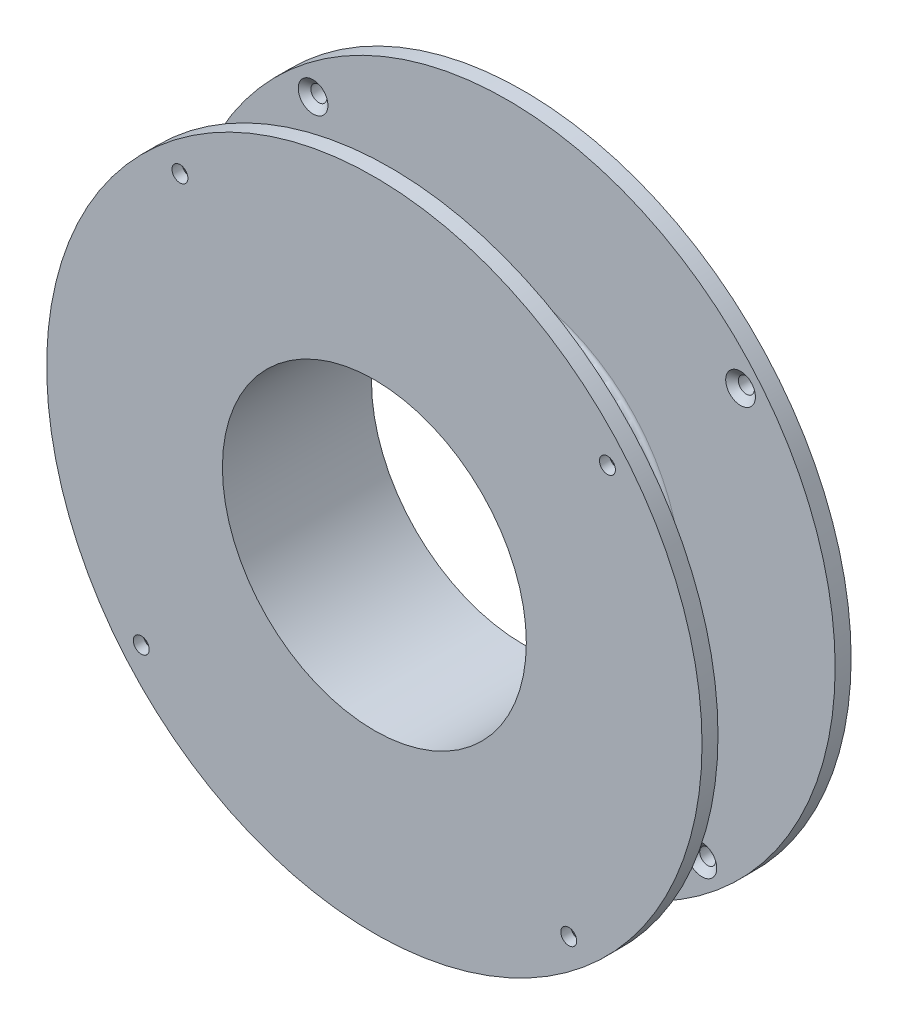
from build123d import *

# Parameters (mm, degrees)
SKETCH2_R          = 1.8288
CUT_EXTRUDE1_DEPTH = 143.234851149
CIRPATTERN1_COUNT  = 4


# Read off the part's stored shape, not the designer's step: CSK for #6 Flat Head Machine Screw (100)1
with BuildPart() as part:
    # Sketch1 → Revolve8 (revolve)
    with BuildSketch(Plane(origin=(0, 0, 0), x_dir=(1, 0, 0), z_dir=(0, 1, 0)), mode=Mode.PRIVATE) as revolve8_sk:
        with BuildLine():
            Line((-42.91, 4.059999872), (-1, 4.059999872))
            Line((-1, 4.059999872), (-1, -31.500000128))
            Line((-1, -31.500000128), (-42.91, -31.500000128))
            Line((-42.91, -31.500000128), (-42.91, -27.690000128))
            Line((-42.91, -27.690000128), (-6.08, -27.690000128))
            ThreePointArc((-6.08, -27.690000128), (-5.181974388, -27.31802574), (-4.81, -26.420000128))
            Line((-4.81, -26.420000128), (-4.81, -1.020000128))
            ThreePointArc((-4.81, -1.020000128), (-5.181974388, -0.121974516), (-6.08, 0.249999872))
            Line((-6.08, 0.249999872), (-42.91, 0.249999872))
            Line((-42.91, 0.249999872), (-42.91, 4.059999872))
        make_face()
    revolve(revolve8_sk.sketch.rotate(Axis((35.2425, 0, 32.45), (0, 0, -1)), 180), axis=Axis((35.2425, 0, 32.45), (0, 0, -1)))

    # Sketch2 → Cut-Extrude1 (cut, through all)
    with BuildSketch(Plane(origin=(0, 0, -4.059999872), x_dir=(-1, 0, 0), z_dir=(0, 0, -1))):
        with Locations((11.122317884, 55.593306815)):
            Circle(SKETCH2_R)
    cut_extrude1 = extrude(amount=-CUT_EXTRUDE1_DEPTH, mode=Mode.SUBTRACT)

    # CirPattern1: Cut-Extrude1 ×4 about axis
    cirpattern1_axis = Axis((35.2425, 0, 0), (0, 0, 1))
    for i in range(1, CIRPATTERN1_COUNT):
        add(cut_extrude1.rotate(cirpattern1_axis, i * 360 / CIRPATTERN1_COUNT), mode=Mode.SUBTRACT)

    # CSK for _6 Flat Head Machine Screw _ 2 → CSK for #6 Flat Head Machine Screw (100)1 (revolve, cut)
    with BuildSketch(Plane(origin=(-11.122317884, 55.593306815, 0), x_dir=(1, 0, 0), z_dir=(0, -1, 0))):
        Polygon((1.89865, 29.070025336), (1.89865, 31.500000128), (1.8288, 31.500000128), (1.8288, 27.690000128), (3.5433, 27.690000128), align=None)
        Polygon((1.89865, -1.63002508), (3.5433, -0.249999872), (1.8288, -0.249999872), (1.8288, -4.059999872), (1.89865, -4.059999872), align=None)
    revolve(axis=Axis((-11.122317884, 55.593306815, 0), (0, 0, 1)), mode=Mode.SUBTRACT)

    # CSK for _6 Flat Head Machine Screw _ 3 o → CSK for _6 Flat Head Machine Screw _ 3 (revolve, cut)
    with BuildSketch(Plane(origin=(-20.350806815, -46.364817884, 0), x_dir=(1, 0, 0), z_dir=(0, -1, 0))):
        Polygon((1.89865, 29.070025336), (1.89865, 31.500000128), (1.8288, 31.500000128), (1.8288, 27.690000128), (3.5433, 27.690000128), align=None)
        Polygon((1.89865, -1.63002508), (3.5433, -0.249999872), (1.8288, -0.249999872), (1.8288, -4.059999872), (1.89865, -4.059999872), align=None)
    revolve(axis=Axis((-20.350806815, -46.364817884, 0), (0, 0, 1)), mode=Mode.SUBTRACT)

    # CSK for _6 Flat Head Machine Screw _ 4 o → CSK for _6 Flat Head Machine Screw _ 4 (revolve, cut)
    with BuildSketch(Plane(origin=(81.607317884, -55.593306815, 0), x_dir=(1, 0, 0), z_dir=(0, -1, 0))):
        Polygon((1.89865, 29.070025336), (1.89865, 31.500000128), (1.8288, 31.500000128), (1.8288, 27.690000128), (3.5433, 27.690000128), align=None)
        Polygon((1.89865, -1.63002508), (3.5433, -0.249999872), (1.8288, -0.249999872), (1.8288, -4.059999872), (1.89865, -4.059999872), align=None)
    revolve(axis=Axis((81.607317884, -55.593306815, 0), (0, 0, 1)), mode=Mode.SUBTRACT)

    # CSK for _6 Flat Head Machine Screw _ 5 o → CSK for _6 Flat Head Machine Screw _ 5 (revolve, cut)
    with BuildSketch(Plane(origin=(90.835806815, 46.364817884, 0), x_dir=(1, 0, 0), z_dir=(0, -1, 0))):
        Polygon((1.89865, 29.070025336), (1.89865, 31.500000128), (1.8288, 31.500000128), (1.8288, 27.690000128), (3.5433, 27.690000128), align=None)
        Polygon((1.89865, -1.63002508), (3.5433, -0.249999872), (1.8288, -0.249999872), (1.8288, -4.059999872), (1.89865, -4.059999872), align=None)
    revolve(axis=Axis((90.835806815, 46.364817884, 0), (0, 0, 1)), mode=Mode.SUBTRACT)


solid = part.part
